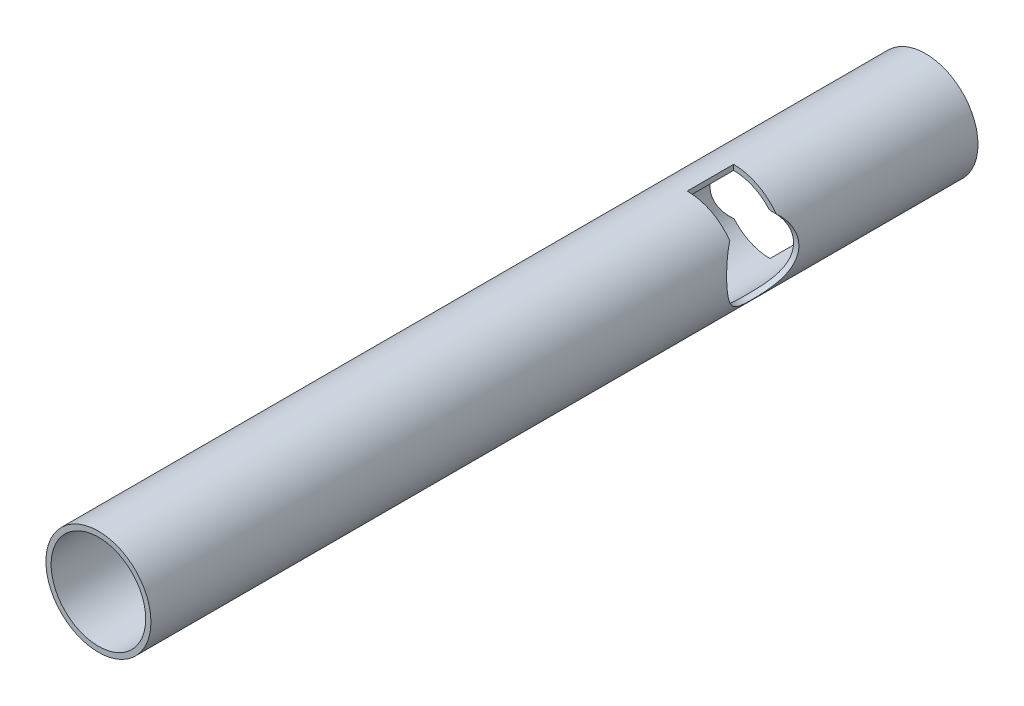
from build123d import *

# Parameters (mm, degrees)
BOSS_EXTRUDE1_DEPTH      = 250
BOSS_EXTRUDE1_DEPTH_BACK = 250
SKETCH1_R                = 31.75
SKETCH1_R_2              = 28.575
SKETCH2_R                = 21.75
CUT_EXTRUDE1_DEPTH       = 255.000246063
SKETCH3_R                = 21.75
CUT_EXTRUDE2_DEPTH       = 255.000246186
SKETCH5_W                = 28
SKETCH5_H                = 22
CUT_EXTRUDE4_DEPTH       = 255.000246186
SKETCH6_W                = 28
SKETCH6_H                = 22
CUT_EXTRUDE5_DEPTH       = 255.000246186


with BuildPart() as part:
    # Sketch1 → Boss-Extrude1 (new, two sides: drawn at the far end of the back side and taken through both)
    with BuildSketch(Plane.XY.offset(-BOSS_EXTRUDE1_DEPTH_BACK)):
        Circle(SKETCH1_R)
        Circle(SKETCH1_R_2, mode=Mode.SUBTRACT)
    extrude(amount=BOSS_EXTRUDE1_DEPTH + BOSS_EXTRUDE1_DEPTH_BACK)

    # Sketch2 → Cut-Extrude1 (cut, through all)
    with BuildSketch(Plane(origin=(0, 0, 0), x_dir=(0, 0, -1), z_dir=(1, 0, 0))):
        with Locations((170, -2)):
            Circle(SKETCH2_R)
    extrude(amount=-CUT_EXTRUDE1_DEPTH, mode=Mode.SUBTRACT)

    # Sketch3 → Cut-Extrude2 (cut, through all)
    with BuildSketch(Plane(origin=(0, 0, 0), x_dir=(0, 0, -1), z_dir=(1, 0, 0))):
        with Locations((120, 2)):
            Circle(SKETCH3_R)
    extrude(amount=CUT_EXTRUDE2_DEPTH, mode=Mode.SUBTRACT)

    # Sketch5 → Cut-Extrude4 (cut, through all)
    with BuildSketch(Plane(origin=(0, 0, 0), x_dir=(0, 0, -1), z_dir=(1, 0, 0))):
        with Locations((170, -23.75)):
            Rectangle(SKETCH5_W, SKETCH5_H)
    extrude(amount=-CUT_EXTRUDE4_DEPTH, mode=Mode.SUBTRACT)

    # Sketch6 → Cut-Extrude5 (cut, through all)
    with BuildSketch(Plane(origin=(0, 0, 0), x_dir=(0, 0, -1), z_dir=(1, 0, 0))):
        with Locations((120, 23.75)):
            Rectangle(SKETCH6_W, SKETCH6_H)
    extrude(amount=CUT_EXTRUDE5_DEPTH, mode=Mode.SUBTRACT)


solid = part.part
